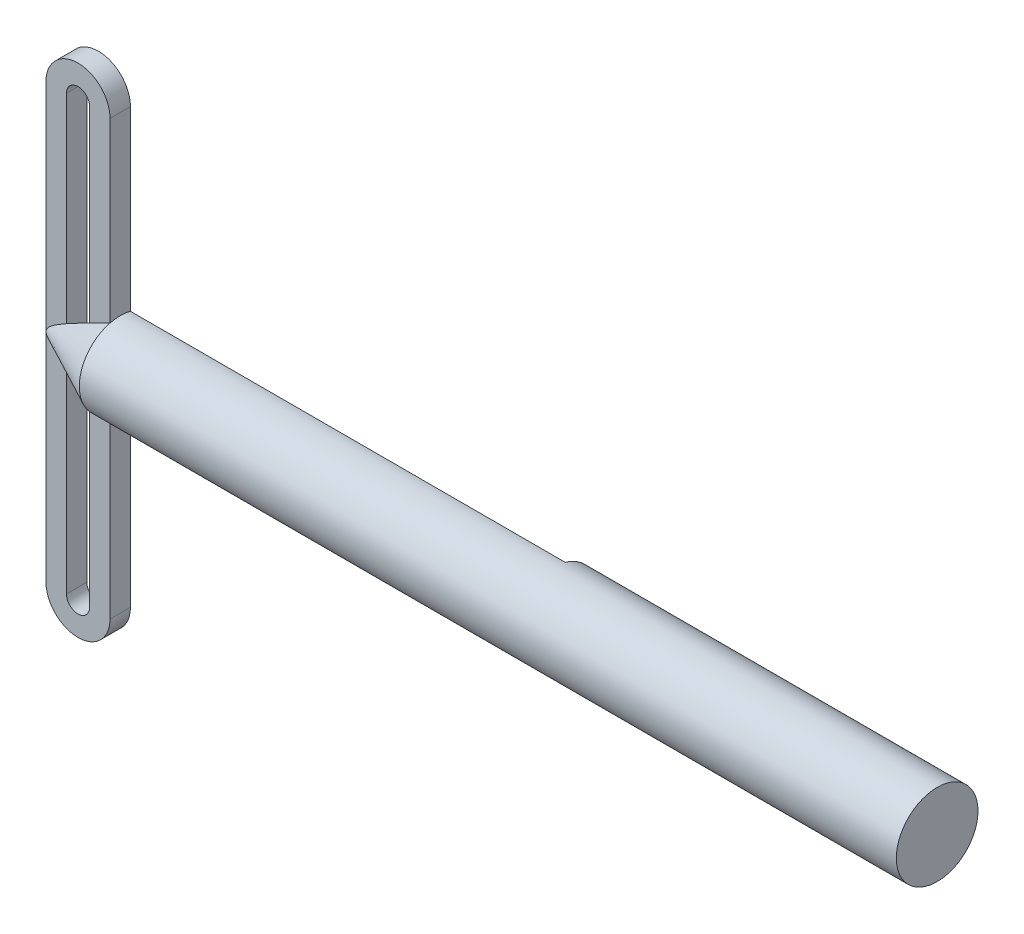
from build123d import *

# Parameters (mm, degrees)
BOSS_EXTRUDE1_DEPTH = 3.175
SKETCH2_R           = 12.7
BOSS_EXTRUDE2_DEPTH = 254
BOSS_EXTRUDE3_START = 19.90327871
BOSS_EXTRUDE3_DEPTH = 19.90327871
SKETCH15_W          = 9.525
SKETCH15_H          = 155.575
CHAMFER1_SIZE       = 19.880208588
CHAMFER1_SIZE_2     = 9.525


with BuildPart() as part:
    # Sketch1 → Boss-Extrude1 (new, symmetric)
    with BuildSketch(Plane.XY):
        with BuildLine():
            Line((9.951639355, 67.400163523), (9.951639355, -67.400163523))
            ThreePointArc((9.951639355, -67.400163523), (0, -77.351802878), (-9.951639355, -67.400163523))
            Line((-9.951639355, -67.400163523), (-9.951639355, 67.400163523))
            ThreePointArc((-9.951639355, 67.400163523), (0, 77.351802878), (9.951639355, 67.400163523))
        make_face()
        with BuildLine():
            Line((3.601639355, 67.400163523), (3.601639355, -67.400163523))
            ThreePointArc((3.601639355, -67.400163523), (0, -71.001802878), (-3.601639355, -67.400163523))
            Line((-3.601639355, -67.400163523), (-3.601639355, 67.400163523))
            ThreePointArc((-3.601639355, 67.400163523), (0, 71.001802878), (3.601639355, 67.400163523))
        make_face(mode=Mode.SUBTRACT)
    extrude(amount=BOSS_EXTRUDE1_DEPTH, both=True)

    # Sketch2 → Boss-Extrude2 (add)
    with BuildSketch(Plane(origin=(9.951639355, 0, 0), x_dir=(0, 0, -1), z_dir=(1, 0, 0))):
        with Locations(Location((0, 0, 0), (0, 0, 104.477512186))):
            Circle(SKETCH2_R)
    extrude(amount=BOSS_EXTRUDE2_DEPTH)

    # Sketch5 → Boss-Extrude3 (add)
    with BuildSketch(Plane.ZY.offset(-9.951639355).offset(BOSS_EXTRUDE3_START)):
        with BuildLine():
            Line((-3.175, -12.296722124), (-3.175, 12.296722124))
            ThreePointArc((-3.175, 12.296722124), (-12.7, 0), (-3.175, -12.296722124))
        make_face()
        with BuildLine():
            Line((3.175, 12.296722124), (3.175, -12.296722124))
            ThreePointArc((3.175, -12.296722124), (12.7, 0), (3.175, 12.296722124))
        make_face()
    extrude(amount=-BOSS_EXTRUDE3_DEPTH)

    # Sketch15 → Cut-Revolve2 (revolve, cut)
    with BuildSketch(Plane.ZY.offset(9.951639355)):
        with Locations((-7.9375, 77.7875)):
            Rectangle(SKETCH15_W, SKETCH15_H)
    revolve(axis=Axis((-9.951639355, 0, -3.175), (0, 0, -1)), mode=Mode.SUBTRACT)

    # Chamfer1
    # the kernel refuses this chamfer: 19.880208588, 9.525 mm, written as the material it takes off along each edge
    with BuildSketch(Plane(origin=(-9.951639355, 0, 0), x_dir=(0, -0.003141587485879782, -0.9999950652018581), z_dir=(0, 0.9999950652018581, -0.003141587485879782))) as chamfer1_piece_1_section:
        Polygon((12.7, -CHAMFER1_SIZE), (12.7 - CHAMFER1_SIZE_2, 0), (12.7, 0), align=None)
    chamfer1_piece_1 = revolve(axis=Axis((-9.951639355, 0, 0), (-1, 0, 0)), revolution_arc=359.64, mode=Mode.PRIVATE)
    chamfer1_piece_1 = split(chamfer1_piece_1, bisect_by=Plane(origin=(-9.951639355, 0, 3.175), z_dir=(0, 0, 1)), keep=Keep.TOP, mode=Mode.PRIVATE)
    add(chamfer1_piece_1, mode=Mode.SUBTRACT)


solid = part.part
